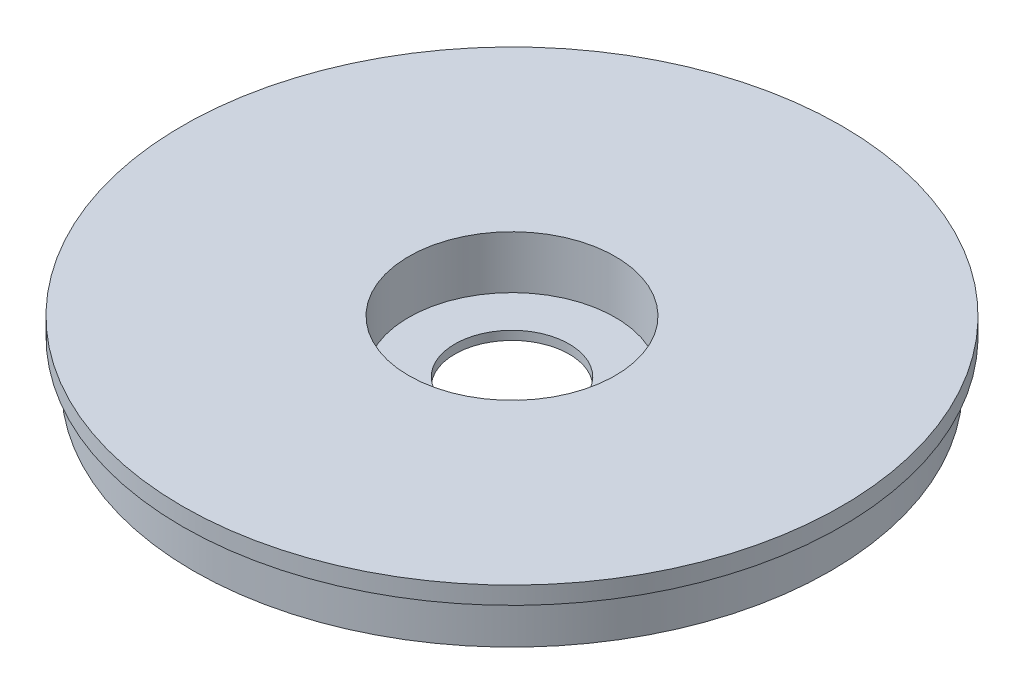
from build123d import *

# Parameters (mm, degrees)
SZKIC4_R                    = 75
DODANIE_WYCI_GNI_CIE2_DEPTH = 14
SZKIC5_R                    = 23.5
WYTNIJ_WYCI_GNI_CIE3_DEPTH  = 12
SZKIC6_R                    = 13
WYTNIJ_WYCI_GNI_CIE4_DEPTH  = 12
SZKIC7_R                    = 75
SZKIC7_R_2                  = 72.5
WYTNIJ_WYCI_GNI_CIE5_DEPTH  = 10
SZKIC9_R                    = 2.5
WYTNIJ_WYCI_GNI_CIE6_DEPTH  = 5


with BuildPart() as part:
    # Szkic4 → Dodanie-wyciągnięcie2 (new body)
    with BuildSketch(Plane(origin=(0, 0, 0), x_dir=(1, 0, 0), z_dir=(0, 1, 0))):
        Circle(SZKIC4_R)
    extrude(amount=DODANIE_WYCI_GNI_CIE2_DEPTH)

    # Szkic5 → Wytnij-wyciągnięcie3 (cut)
    with BuildSketch(Plane(origin=(0, 14, 0), x_dir=(1, 0, 0), z_dir=(0, 1, 0))):
        Circle(SZKIC5_R)
    extrude(amount=-WYTNIJ_WYCI_GNI_CIE3_DEPTH, mode=Mode.SUBTRACT)

    # Szkic6 → Wytnij-wyciągnięcie4 (cut)
    with BuildSketch(Plane(origin=(0, 2, 0), x_dir=(1, 0, 0), z_dir=(0, 1, 0))):
        Circle(SZKIC6_R)
    extrude(amount=-WYTNIJ_WYCI_GNI_CIE4_DEPTH, mode=Mode.SUBTRACT)

    # Szkic7 → Wytnij-wyciągnięcie5 (cut)
    with BuildSketch(Plane.XZ):
        Circle(SZKIC7_R)
        Circle(SZKIC7_R_2, mode=Mode.SUBTRACT)
    extrude(amount=-WYTNIJ_WYCI_GNI_CIE5_DEPTH, mode=Mode.SUBTRACT)

    # Szkic9 → Wytnij-wyciągnięcie6 (cut)
    with BuildSketch(Plane(origin=(0, 0, 0), x_dir=(-1, 0, 0), z_dir=(0, -1, 0))):
        with Locations((21.654857569, 28.260036158)):
            Circle(SZKIC9_R)
        with Locations((12.9417522, 33.167356693)):
            Circle(SZKIC9_R)
    extrude(amount=-WYTNIJ_WYCI_GNI_CIE6_DEPTH, mode=Mode.SUBTRACT)


solid = part.part
